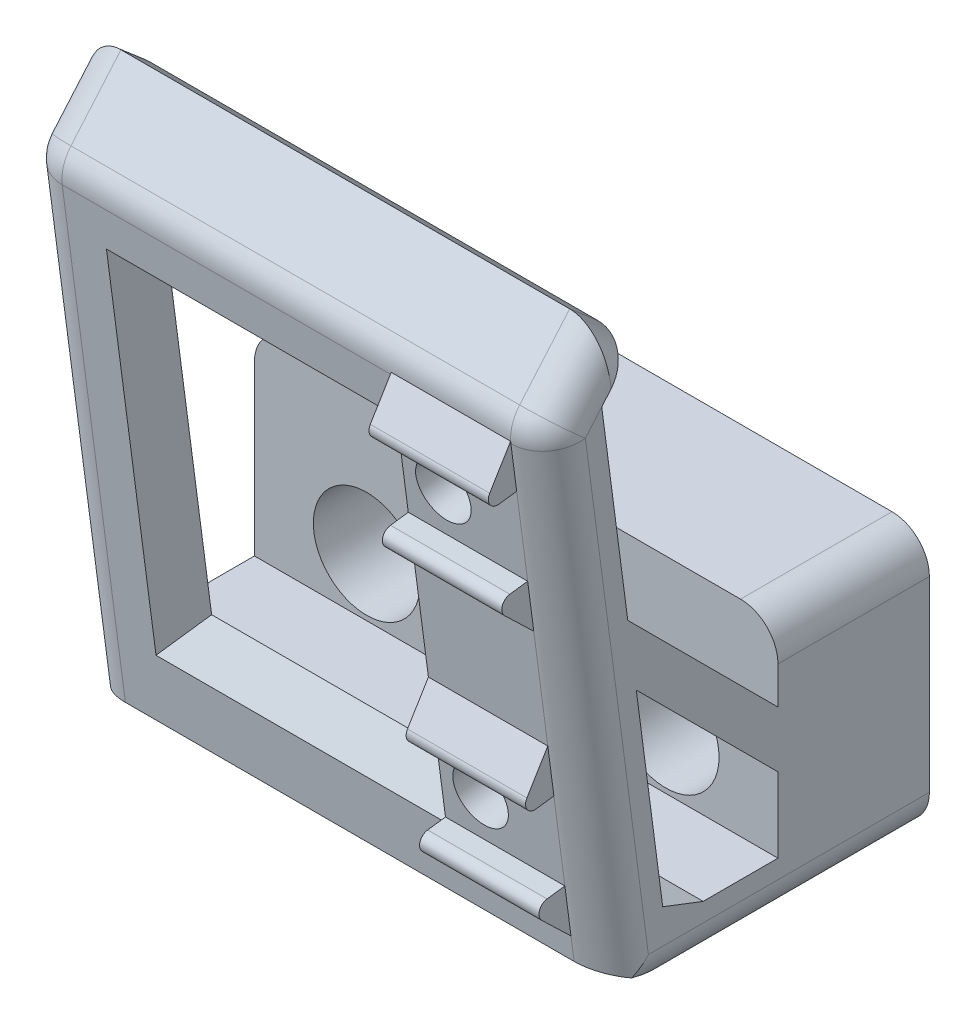
from build123d import *

# Parameters (mm, degrees)
BOSS_EXTRUDE1_START = 2
SKETCH2_W           = 28
SKETCH2_H           = 14
SKETCH2_R           = 2.85
BOSS_EXTRUDE1_DEPTH = 8.1
BOSS_EXTRUDE5_DEPTH = 28
CUT_EXTRUDE1_REACH  = 83.112
SKETCH7_R           = 1.475
SKETCH7_W           = 15.52
SKETCH7_H           = 20.32
BOSS_EXTRUDE7_DEPTH = 2
FILLET1_R           = 2
BOSS_EXTRUDE8_START = -2
BOSS_EXTRUDE8_DEPTH = 6.386
FILLET2_R           = 0.5


with BuildPart() as part:
    # Sketch2 → Boss-Extrude1 (new body)
    with BuildSketch(Plane.XY.offset(BOSS_EXTRUDE1_START)):
        with Locations((-62.5, -8)):
            Rectangle(SKETCH2_W, SKETCH2_H)
        with Locations((-54.5, -8.9)):
            Circle(SKETCH2_R, mode=Mode.SUBTRACT)
        with Locations((-70.5, -8.9)):
            Circle(SKETCH2_R, mode=Mode.SUBTRACT)
    extrude(amount=BOSS_EXTRUDE1_DEPTH)

    # Sketch6 → Boss-Extrude5 (add)
    with BuildSketch(Plane.ZY.offset(76.5)):
        Polygon((10.1, -15), (14.656017135, -15), (19.003880422, -13.331011655), (22.5, 13.224653006), (19.240190464, 17.015911609), (17.723687023, 15.711987794), (19.525665416, 13.616231583), (16.26251061, -11.169889951), (14.1, -12), (10.1, -12), align=None)
    extrude(amount=-BOSS_EXTRUDE5_DEPTH)

    # Sketch7 → Cut-Extrude1 (cut, up to next)
    with BuildSketch(Plane(origin=(0, -2.686404695, 20.405269514), x_dir=(1, 0, 0), z_dir=(0, -0.13052619222004436, 0.9914448613738114)), mode=Mode.PRIVATE) as cut_extrude1_sk1:
        with Locations(Location((-54.716, -4.710052631, 0), (0, 0, 270))):
            Circle(SKETCH7_R)
    cut_extrude1_tool1 = extrude(cut_extrude1_sk1.sketch, amount=-CUT_EXTRUDE1_REACH, mode=Mode.PRIVATE) & part.part
    # Sketch7 → Cut-Extrude1 (cut, up to next)
    with BuildSketch(Plane(origin=(0, -2.686404695, 20.405269514), x_dir=(1, 0, 0), z_dir=(0, -0.13052619222004436, 0.9914448613738114)), mode=Mode.PRIVATE) as cut_extrude1_sk2:
        with Locations(Location((-54.716, 10.529947369, 0), (0, 0, 270))):
            Circle(SKETCH7_R)
    cut_extrude1_tool2 = extrude(cut_extrude1_sk2.sketch, amount=-CUT_EXTRUDE1_REACH, mode=Mode.PRIVATE) & part.part
    # Sketch7 → Cut-Extrude1 (cut, up to next)
    with BuildSketch(Plane(origin=(0, -2.686404695, 20.405269514), x_dir=(1, 0, 0), z_dir=(0, -0.13052619222004436, 0.9914448613738114)), mode=Mode.PRIVATE) as cut_extrude1_sk3:
        with Locations((-64.646, 2.909947369)):
            Rectangle(SKETCH7_W, SKETCH7_H)
    cut_extrude1_tool3 = extrude(cut_extrude1_sk3.sketch, amount=-CUT_EXTRUDE1_REACH, mode=Mode.PRIVATE) & part.part
    add(cut_extrude1_tool1.solids().sort_by_distance((-54.716, -7.356162, 19.790484))[0], mode=Mode.SUBTRACT)
    add(cut_extrude1_tool2.solids().sort_by_distance((-54.716, 7.753458, 21.779703))[0], mode=Mode.SUBTRACT)
    add(cut_extrude1_tool3.solids().sort_by_distance((-64.646, 0.198648, 20.785094))[0], mode=Mode.SUBTRACT)

    # Sketch10 → Boss-Extrude7 (add)
    with BuildSketch(Plane(origin=(-48.5, 0, 0), x_dir=(0, 0, -1), z_dir=(1, 0, 0))):
        Polygon((-18.13225899, 3.03225899), (-17.67742093, -0.42257907), (-10.1, -8), (-10.1, -5), align=None)
    extrude(amount=-BOSS_EXTRUDE7_DEPTH)

    # Fillet1
    # the kernel refuses this fillet: 2 mm, written as the material it takes off along each edge
    with BuildSketch(Plane(origin=(-50.5, 12.598930148, 20.400364102), x_dir=(0, 0.6519619071782031, 0.758251720465282), z_dir=(1, 0, 0))) as fillet1_piece_1_section:
        Polygon((0, 0), (FILLET1_R * 1.02, 0), (FILLET1_R * 1.02, FILLET1_R * 0.45615786741), (FILLET1_R * 0.68, FILLET1_R * 0.76026311235), align=None)
    fillet1_piece_1 = extrude(amount=FILLET1_R * 1.02, mode=Mode.PRIVATE)
    fillet1_piece_1 = fillet1_piece_1 - Plane(origin=(-50.5, 12.598930148, 20.400364102), x_dir=(0, -0.28560210337141756, -0.9583482866629555), z_dir=(1, 0, 0)) * Sphere(FILLET1_R, mode=Mode.PRIVATE)
    add(fillet1_piece_1, mode=Mode.SUBTRACT)
    with BuildSketch(Plane(origin=(-74.5, 12.598930148, 20.400364102), x_dir=(0, 0.6519619071782031, 0.758251720465282), z_dir=(-1, 0, 0))) as fillet1_piece_2_section:
        Polygon((0, 0), (FILLET1_R * 1.02, 0), (FILLET1_R * 1.02, -FILLET1_R * 0.45615786741), (FILLET1_R * 0.68, -FILLET1_R * 0.76026311235), align=None)
    fillet1_piece_2 = extrude(amount=FILLET1_R * 1.02, mode=Mode.PRIVATE)
    fillet1_piece_2 = fillet1_piece_2 - Plane(origin=(-74.5, 12.598930148, 20.400364102), x_dir=(0, -0.28560210337141756, -0.9583482866629555), z_dir=(-1, 0, 0)) * Sphere(FILLET1_R, mode=Mode.PRIVATE)
    add(fillet1_piece_2, mode=Mode.SUBTRACT)
    with BuildSketch(Plane(origin=(-76.5, -15, 19.656017135), x_dir=(1, 0, 0), z_dir=(0, 0, -1)), Plane(origin=(-48.5, -15, -3), x_dir=(-1, 0, 0), z_dir=(0, 0, 1))) as fillet1_piece_3:
        with BuildLine():
            CenterArc((FILLET1_R, -FILLET1_R), FILLET1_R, 90, 90)
            Line((0, -FILLET1_R), (0, 0))
            Line((0, 0), (FILLET1_R, 0))
        make_face()
    extrude(amount=22.656017135, mode=Mode.SUBTRACT)
    with BuildSketch(Plane(origin=(-76.5, -1, -3), x_dir=(0, -1, 0), z_dir=(0, 0, 1))) as fillet1_piece_4:
        with BuildLine():
            CenterArc((FILLET1_R, FILLET1_R), FILLET1_R, 180, 90)
            Line((0, FILLET1_R), (0, 0))
            Line((0, 0), (FILLET1_R, 0))
        make_face()
    extrude(amount=18.1, mode=Mode.SUBTRACT)
    with BuildSketch(Plane(origin=(-48.5, -1, -3), x_dir=(0, -1, 0), z_dir=(0, 0, 1))) as fillet1_piece_5_section:
        with BuildLine():
            CenterArc((FILLET1_R, -FILLET1_R), FILLET1_R, 90, 90)
            Line((0, -FILLET1_R), (0, 0))
            Line((0, 0), (FILLET1_R, 0))
        make_face()
    fillet1_piece_5 = extrude(amount=18.1, mode=Mode.PRIVATE)
    fillet1_piece_5 = split(fillet1_piece_5, bisect_by=Plane(origin=(-48.946735878, -5.248367939, 9.851632061), z_dir=(0, 0.707106781186545, -0.7071067811865501)), keep=Keep.TOP, mode=Mode.PRIVATE)
    add(fillet1_piece_5, mode=Mode.SUBTRACT)
    with BuildSketch(Plane(origin=(-48.5, 13.902853963, 21.916867543), x_dir=(0, -0.6519619071782031, -0.758251720465282), z_dir=(0, 0.758251720465282, -0.6519619071782031))) as fillet1_piece_6:
        with BuildLine():
            CenterArc((FILLET1_R, FILLET1_R), FILLET1_R, 180, 90)
            Line((0, FILLET1_R), (0, 0))
            Line((0, 0), (FILLET1_R, 0))
        make_face()
    extrude(amount=9.105572809, mode=Mode.SUBTRACT)
    with BuildSketch(Plane(origin=(-76.5, 13.902853963, 21.916867543), x_dir=(0, -0.6519619071782031, -0.758251720465282), z_dir=(0, 0.758251720465282, -0.6519619071782031))) as fillet1_piece_7:
        with BuildLine():
            CenterArc((FILLET1_R, -FILLET1_R), FILLET1_R, 90, 90)
            Line((0, -FILLET1_R), (0, 0))
            Line((0, 0), (FILLET1_R, 0))
        make_face()
    extrude(amount=9.105572809, mode=Mode.SUBTRACT)
    with BuildSketch(Plane(origin=(-48.5, -18.288235962, 18.351249461), x_dir=(0, 0.1305261922200442, -0.9914448613738114), z_dir=(0, 0.9914448613738114, 0.13052619222004422))) as fillet1_piece_8:
        with BuildLine():
            CenterArc((FILLET1_R, FILLET1_R), FILLET1_R, 180, 90)
            Line((0, FILLET1_R), (0, 0))
            Line((0, 0), (FILLET1_R, 0))
        make_face()
    extrude(amount=30.890385254, mode=Mode.SUBTRACT)
    with BuildSketch(Plane(origin=(-76.5, -18.288235962, 18.351249461), x_dir=(0, 0.1305261922200442, -0.9914448613738114), z_dir=(0, 0.9914448613738114, 0.13052619222004422))) as fillet1_piece_9:
        with BuildLine():
            CenterArc((FILLET1_R, -FILLET1_R), FILLET1_R, 90, 90)
            Line((0, -FILLET1_R), (0, 0))
            Line((0, 0), (FILLET1_R, 0))
        make_face()
    extrude(amount=30.890385254, mode=Mode.SUBTRACT)
    with BuildSketch(Plane(origin=(-74.5, 13.224653006, 22.5), x_dir=(0, 0.7582517204652818, -0.6519619071782033), z_dir=(1, 0, 0))) as fillet1_piece_10:
        with BuildLine():
            CenterArc((FILLET1_R * 0.4472135955, -FILLET1_R), FILLET1_R, 90, 48.189685104)
            Line((-FILLET1_R * 0.298142397, -FILLET1_R * 0.333333333333), (0, 0))
            Line((0, 0), (FILLET1_R * 0.4472135955, 0))
        make_face()
    extrude(amount=24, mode=Mode.SUBTRACT)
    with BuildSketch(Plane(origin=(-48.5, 20.275721145, 23.031449066), x_dir=(0, -0.7582517204652808, 0.6519619071782047), z_dir=(0, -0.6519619071782047, -0.7582517204652808))) as fillet1_piece_11:
        with BuildLine():
            CenterArc((FILLET1_R, FILLET1_R), FILLET1_R, 180, 90)
            Line((0, FILLET1_R), (0, 0))
            Line((0, 0), (FILLET1_R, 0))
        make_face()
    extrude(amount=12, mode=Mode.SUBTRACT)
    with BuildSketch(Plane(origin=(-76.5, 20.275721145, 23.031449066), x_dir=(0, -0.7582517204652808, 0.6519619071782046), z_dir=(0, -0.6519619071782047, -0.7582517204652808))) as fillet1_piece_12:
        with BuildLine():
            CenterArc((FILLET1_R, -FILLET1_R), FILLET1_R, 90, 90)
            Line((0, -FILLET1_R), (0, 0))
            Line((0, 0), (FILLET1_R, 0))
        make_face()
    extrude(amount=12, mode=Mode.SUBTRACT)

    # Sketch11 → Boss-Extrude8 (add)
    with BuildSketch(Plane(origin=(-48.5, 0, 0), x_dir=(0, 0, -1), z_dir=(1, 0, 0)).offset(BOSS_EXTRUDE8_START)):
        Polygon((-21.159704036, 3.044094423), (-23.468909239, 5.261654192), (-21.486019516, 5.522706576), align=None)
        Polygon((-22.399702862, 12.462820606), (-22.073387381, 9.984208452), (-24.056277104, 9.723156068), align=None)
        Polygon((-21.479690069, -9.847965496), (-19.496800347, -9.586913111), (-19.170484866, -12.065525265), align=None)
        Polygon((-22.067057934, -5.386463619), (-20.084168212, -5.125411235), (-20.410483692, -2.646799082), align=None)
    extrude(amount=-BOSS_EXTRUDE8_DEPTH)

    # Fillet2
    fillet2_edges = [part.edges().sort_by_distance(p)[0] for p in [
        (-53.693, 5.261654192, 23.468909239),
        (-53.693, 9.723156068, 24.056277104),
        (-53.693, -5.386463619, 22.067057934),
        (-53.693, -9.847965496, 21.479690069),
    ]]
    fillet(fillet2_edges, radius=FILLET2_R)


solid = part.part
